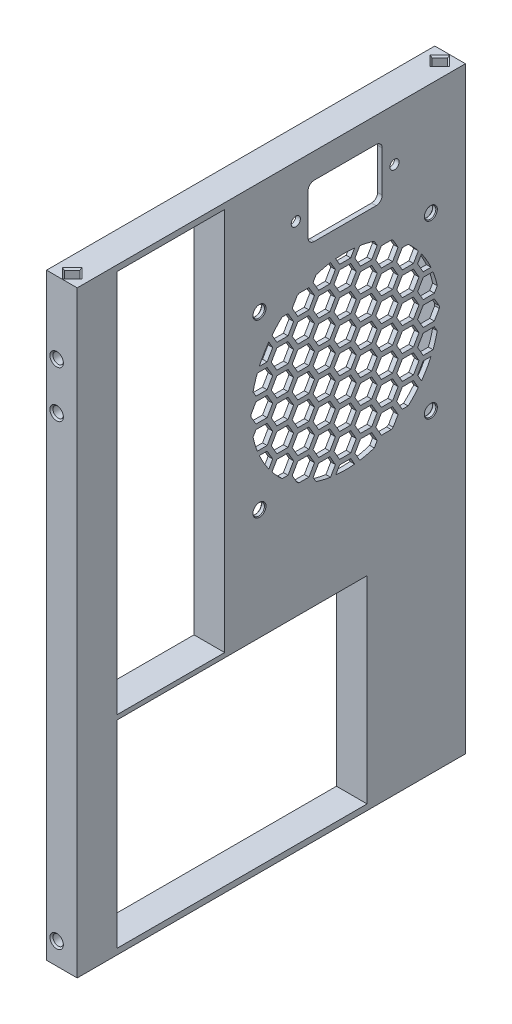
from build123d import *

# Parameters (mm, degrees)
SKETCH47_W                             = 160.866666667
SKETCH47_H                             = 247.65
SKETCH47_W_2                           = 44.704
SKETCH47_H_2                           = 159.004
SKETCH47_W_3                           = 103.7209
SKETCH47_H_3                           = 81.915
BOSS_EXTRUDE1_DEPTH                    = 12.7
BOSS_EXTRUDE6_DEPTH                    = 1.905
CUT_EXTRUDE4_REACH                     = 159.117
POWER_CABLE_ADAPTER_SCREWHOLES_D       = 3.7973
GPU_MOUNTING_SCREWHOLES_D              = 4.3053
GPU_MOUNTING_SCREWHOLES_DEPTH          = 4.572
GPU_MOUNTING_SCREWHOLES_CSINK_D        = 5.5753
GPU_MOUNTING_SCREWHOLES_CSINK_ANGLE    = 90
GPU_MOUNTING_SCREWHOLES_TIP            = 1.293442612
GPU_SCREW_ACCESS_HOLES_REACH           = 207.287
CUT_EXTRUDE1_REACH                     = 159.117
FILL_START                             = 10.795
FILL_PATTERN1_DEPTH                    = 1.905
SKETCH64_W                             = 82.922533333
SKETCH64_H                             = 128.9685
SKETCH64_R                             = 39
BOSS_EXTRUDE7_DEPTH                    = 1.905
F_3_16_0_1875_DIAMETER_HOLE1_D         = 4.7625
F_3_16_0_1875_DIAMETER_HOLE1_DEPTH     = 5.588
F_3_16_0_1875_DIAMETER_HOLE1_TIP       = 1.430799349
CHAMFER2_SIZE                          = 0.3175
BOTTOM_PINS_DEPTH                      = 6.35
FRONT_PINS_DEPTH                       = 6.35
CUT_EXTRUDE3_DEPTH                     = 6.35
PIN_CHAMFER_SIZE                       = 0.635
SKETCH69_W                             = 13.216466667
SKETCH69_H                             = 81.915
CUT_EXTRUDE2_DEPTH                     = 1.27
F_18_0_1695_DIAMETER_HOLE3_D           = 4.3053
F_18_0_1695_DIAMETER_HOLE3_DEPTH       = 8.382
F_18_0_1695_DIAMETER_HOLE3_CSINK_D     = 5.5753
F_18_0_1695_DIAMETER_HOLE3_CSINK_ANGLE = 90
F_18_0_1695_DIAMETER_HOLE3_TIP         = 1.293442612
SKETCH74_W                             = 5.08
SKETCH74_H                             = 83.82
CUT_EXTRUDE5_DEPTH                     = 1.27
CHAMFER3_SIZE                          = 1.27


# Read off the part's stored shape, not the designer's step: Fill Pattern1, #18 (0.1695) Diameter Hole2
with BuildPart() as part:
    # Sketch47 → Boss-Extrude1 (new body)
    with BuildSketch(Plane(origin=(0, 0, 0), x_dir=(0, 0, -1), z_dir=(1, 0, 0))):
        with Locations((11.578166667, 3.0734)):
            Rectangle(SKETCH47_W, SKETCH47_H)
        with Locations((-30.1117, 44.9834)):
            Rectangle(SKETCH47_W_2, SKETCH47_H_2, mode=Mode.SUBTRACT)
        Polygon((83.6295, 124.4854), (83.6295, -105.70845), (70.99935, -118.3386), (58.3692, -118.3386), (58.3692, -34.5186), (0.706966667, -34.5186), (0.706966667, 124.4854), align=None, mode=Mode.SUBTRACT)
        with Locations((-0.60325, -77.3811)):
            Rectangle(SKETCH47_W_3, SKETCH47_H_3, mode=Mode.SUBTRACT)
    extrude(amount=BOSS_EXTRUDE1_DEPTH)

    # Sketch50 → Boss-Extrude6 (add)
    with BuildSketch(Plane.ZY.offset(-12.7)):
        Polygon((-58.3692, -34.5186), (-58.3692, -118.3386), (-83.6295, -118.3386), (-83.6295, 124.4854), (-0.706966667, 124.4854), (-0.706966667, -34.5186), align=None)
    extrude(amount=BOSS_EXTRUDE6_DEPTH)

    # Sketch73 → Cut-Extrude4 (cut, up to next)
    with BuildSketch(Plane.ZY.offset(-10.795), mode=Mode.PRIVATE) as cut_extrude4_sk1:
        with BuildLine():
            Line((-26.801233333, 96.9899), (-26.801233333, 113.8809))
            ThreePointArc((-26.801233333, 113.8809), (-27.545182109, 115.676951224), (-29.341233333, 116.4209))
            Line((-29.341233333, 116.4209), (-54.995233333, 116.4209))
            ThreePointArc((-54.995233333, 116.4209), (-56.791284558, 115.676951224), (-57.535233333, 113.8809))
            Line((-57.535233333, 113.8809), (-57.535233333, 96.9899))
            ThreePointArc((-57.535233333, 96.9899), (-56.791284558, 95.193848776), (-54.995233333, 94.4499))
            Line((-54.995233333, 94.4499), (-29.341233333, 94.4499))
            ThreePointArc((-29.341233333, 94.4499), (-27.545182109, 95.193848776), (-26.801233333, 96.9899))
        make_face()
    cut_extrude4_tool1 = extrude(cut_extrude4_sk1.sketch, amount=-CUT_EXTRUDE4_REACH, mode=Mode.PRIVATE) & part.part
    add(cut_extrude4_tool1.solids().sort_by_distance((10.795, 105.4354, -42.168233))[0], mode=Mode.SUBTRACT)

    # power cable adapter screwholes (through all)
    with Locations(Plane.ZY.offset(-10.795)):
        with Locations((-62.615233333, 105.4354), (-21.721233333, 105.4354)):
            Hole(POWER_CABLE_ADAPTER_SCREWHOLES_D / 2)

    # GPU mounting screwholes
    with Locations(Plane(origin=(0, 0, -58.3692), x_dir=(-1, 0, 0), z_dir=(0, 0, -1))):
        with Locations((-5.08, -58.800000002), (-5.08, -79.120000002), (-5.08, -99.440000002), (-5.08, -38.354)):
            CounterSinkHole(GPU_MOUNTING_SCREWHOLES_D / 2, GPU_MOUNTING_SCREWHOLES_CSINK_D / 2, depth=GPU_MOUNTING_SCREWHOLES_DEPTH, counter_sink_angle=GPU_MOUNTING_SCREWHOLES_CSINK_ANGLE)
            with Locations((0, 0, -(GPU_MOUNTING_SCREWHOLES_DEPTH + GPU_MOUNTING_SCREWHOLES_TIP / 2))):  # 118° drill point
                Cone(0, GPU_MOUNTING_SCREWHOLES_D / 2, GPU_MOUNTING_SCREWHOLES_TIP, mode=Mode.SUBTRACT)

    # Sketch55 → GPU screw access holes (cut, up to next)
    with BuildSketch(Plane(origin=(0, 0, -92.0115), x_dir=(-1, 0, 0), z_dir=(0, 0, -1)), mode=Mode.PRIVATE) as gpu_screw_access_holes_sk1:
        Polygon((-0.680590949, -38.354), (-2.880295474, -34.544), (-7.279704526, -34.544), (-9.479409051, -38.354), (-7.279704526, -42.164), (-2.880295474, -42.164), align=None)
    gpu_screw_access_holes_tool1 = extrude(gpu_screw_access_holes_sk1.sketch, amount=-GPU_SCREW_ACCESS_HOLES_REACH, mode=Mode.PRIVATE) & part.part
    # Sketch55 → GPU screw access holes (cut, up to next)
    with BuildSketch(Plane(origin=(0, 0, -92.0115), x_dir=(-1, 0, 0), z_dir=(0, 0, -1)), mode=Mode.PRIVATE) as gpu_screw_access_holes_sk2:
        Polygon((-0.680590949, -58.800000002), (-2.880295474, -54.990000002), (-7.279704526, -54.990000002), (-9.479409051, -58.800000002), (-7.279704526, -62.610000002), (-2.880295474, -62.610000002), align=None)
    gpu_screw_access_holes_tool2 = extrude(gpu_screw_access_holes_sk2.sketch, amount=-GPU_SCREW_ACCESS_HOLES_REACH, mode=Mode.PRIVATE) & part.part
    # Sketch55 → GPU screw access holes (cut, up to next)
    with BuildSketch(Plane(origin=(0, 0, -92.0115), x_dir=(-1, 0, 0), z_dir=(0, 0, -1)), mode=Mode.PRIVATE) as gpu_screw_access_holes_sk3:
        Polygon((-0.680590949, -79.120000002), (-2.880295474, -75.310000002), (-7.279704526, -75.310000002), (-9.479409051, -79.120000002), (-7.279704526, -82.930000002), (-2.880295474, -82.930000002), align=None)
    gpu_screw_access_holes_tool3 = extrude(gpu_screw_access_holes_sk3.sketch, amount=-GPU_SCREW_ACCESS_HOLES_REACH, mode=Mode.PRIVATE) & part.part
    # Sketch55 → GPU screw access holes (cut, up to next)
    with BuildSketch(Plane(origin=(0, 0, -92.0115), x_dir=(-1, 0, 0), z_dir=(0, 0, -1)), mode=Mode.PRIVATE) as gpu_screw_access_holes_sk4:
        Polygon((-0.680590949, -99.440000002), (-2.880295474, -95.630000002), (-7.279704526, -95.630000002), (-9.479409051, -99.440000002), (-7.279704526, -103.250000002), (-2.880295474, -103.250000002), align=None)
    gpu_screw_access_holes_tool4 = extrude(gpu_screw_access_holes_sk4.sketch, amount=-GPU_SCREW_ACCESS_HOLES_REACH, mode=Mode.PRIVATE) & part.part
    add(gpu_screw_access_holes_tool1.solids().sort_by_distance((5.08, -38.354, -92.0115))[0], mode=Mode.SUBTRACT)
    add(gpu_screw_access_holes_tool2.solids().sort_by_distance((5.08, -58.8, -92.0115))[0], mode=Mode.SUBTRACT)
    add(gpu_screw_access_holes_tool3.solids().sort_by_distance((5.08, -79.12, -92.0115))[0], mode=Mode.SUBTRACT)
    add(gpu_screw_access_holes_tool4.solids().sort_by_distance((5.08, -99.44, -92.0115))[0], mode=Mode.SUBTRACT)

    # Sketch63 → Cut-Extrude1 (cut, up to next)
    with BuildSketch(Plane.ZY.offset(-10.795), mode=Mode.PRIVATE) as cut_extrude1_sk1:
        Polygon((-37.54943118, 44.9834), (-39.858832257, 48.9834), (-44.47763441, 48.9834), (-46.787035487, 44.9834), (-44.47763441, 40.9834), (-39.858832257, 40.9834), align=None)
    cut_extrude1_tool1 = extrude(cut_extrude1_sk1.sketch, amount=-CUT_EXTRUDE1_REACH, mode=Mode.PRIVATE) & part.part
    add(cut_extrude1_tool1.solids().sort_by_distance((10.795, 44.9834, -42.168233))[0], mode=Mode.SUBTRACT)

    # Fill Pattern1 outline → Fill Pattern1 (cut)
    with BuildSketch(Plane.YZ.offset(FILL_START)):
        Polygon((18.9834, -57.179340332), (14.9834, -54.869939256), (10.9834, -57.179340332), (10.9834, -61.798142486), (14.9834, -64.107543563), (18.9834, -61.798142486), align=None)
        Polygon((33.9834, -48.519086294), (29.9834, -46.209685218), (25.9834, -48.519086294), (25.9834, -53.137888448), (29.9834, -55.447289525), (33.9834, -53.137888448), align=None)
        Polygon((78.9834, -22.538324181), (74.9834, -20.228923104), (70.9834, -22.538324181), (70.9834, -27.157126334), (74.9834, -29.466527411), (78.9834, -27.157126334), align=None)
        Polygon((63.9834, -31.198578219), (59.9834, -28.889177142), (55.9834, -31.198578219), (55.9834, -35.817380372), (59.9834, -38.126781449), (63.9834, -35.817380372), align=None)
        Polygon((44.9834, -54.869939256), (40.9834, -57.179340332), (40.9834, -61.798142486), (44.9834, -64.107543563), (48.9834, -61.798142486), (48.9834, -57.179340332), align=None)
        Polygon((44.9834, -72.190447331), (40.9834, -74.499848408), (40.9834, -79.118650561), (44.9834, -81.428051638), (48.9834, -79.118650561), (48.9834, -74.499848408), align=None)
        Polygon((44.9834, -20.228923104), (40.9834, -22.538324181), (40.9834, -27.157126334), (44.9834, -29.466527411), (48.9834, -27.157126334), (48.9834, -22.538324181), align=None)
        Polygon((44.9834, -2.908415028), (40.9834, -5.217816105), (40.9834, -9.836618259), (44.9834, -12.146019335), (48.9834, -9.836618259), (48.9834, -5.217816105), align=None)
        Polygon((70.9834, -57.179340332), (70.9834, -61.798142486), (74.9834, -64.107543563), (78.9834, -61.798142486), (78.9834, -57.179340332), (74.9834, -54.869939256), align=None)
        Polygon((55.9834, -48.519086294), (55.9834, -53.137888448), (59.9834, -55.447289525), (63.9834, -53.137888448), (63.9834, -48.519086294), (59.9834, -46.209685218), align=None)
        Polygon((10.9834, -22.538324181), (10.9834, -27.157126334), (14.9834, -29.466527411), (18.9834, -27.157126334), (18.9834, -22.538324181), (14.9834, -20.228923104), align=None)
        Polygon((25.9834, -31.198578219), (25.9834, -35.817380372), (29.9834, -38.126781449), (33.9834, -35.817380372), (33.9834, -31.198578219), (29.9834, -28.889177142), align=None)
        Polygon((28.9834, -5.217816105), (24.9834, -2.908415028), (20.9834, -5.217816105), (20.9834, -9.836618259), (24.9834, -12.146019335), (28.9834, -9.836618259), align=None)
        Polygon((24.9834, -54.869939256), (20.9834, -57.179340332), (20.9834, -61.798142486), (24.9834, -64.107543563), (28.9834, -61.798142486), (28.9834, -57.179340332), align=None)
        Polygon((24.9834, -72.190447331), (20.9834, -74.499848408), (20.9834, -79.118650561), (24.9834, -81.428051638), (28.9834, -79.118650561), (28.9834, -74.499848408), align=None)
        Polygon((24.9834, -20.228923104), (20.9834, -22.538324181), (20.9834, -27.157126334), (24.9834, -29.466527411), (28.9834, -27.157126334), (28.9834, -22.538324181), align=None)
        Polygon((24.9834, -37.54943118), (20.9834, -39.858832257), (20.9834, -44.47763441), (24.9834, -46.787035487), (28.9834, -44.47763441), (28.9834, -39.858832257), align=None)
        Polygon((80.9834, -39.858832257), (80.9834, -44.47763441), (84.9834, -46.787035487), (88.9834, -44.47763441), (88.9834, -39.858832257), (84.9834, -37.54943118), align=None)
        Polygon((50.9834, -22.538324181), (50.9834, -27.157126334), (54.9834, -29.466527411), (58.9834, -27.157126334), (58.9834, -22.538324181), (54.9834, -20.228923104), align=None)
        Polygon((35.9834, -13.878070143), (35.9834, -18.496872297), (39.9834, -20.806273373), (43.9834, -18.496872297), (43.9834, -13.878070143), (39.9834, -11.568669066), align=None)
        Polygon((65.9834, -31.198578219), (65.9834, -35.817380372), (69.9834, -38.126781449), (73.9834, -35.817380372), (73.9834, -31.198578219), (69.9834, -28.889177142), align=None)
        Polygon((38.9834, -57.179340332), (34.9834, -54.869939256), (30.9834, -57.179340332), (30.9834, -61.798142486), (34.9834, -64.107543563), (38.9834, -61.798142486), align=None)
        Polygon((53.9834, -48.519086294), (49.9834, -46.209685218), (45.9834, -48.519086294), (45.9834, -53.137888448), (49.9834, -55.447289525), (53.9834, -53.137888448), align=None)
        Polygon((23.9834, -65.83959437), (19.9834, -63.530193293), (15.9834, -65.83959437), (15.9834, -70.458396524), (19.9834, -72.7677976), (23.9834, -70.458396524), align=None)
        Polygon((83.9834, -31.198578219), (79.9834, -28.889177142), (75.9834, -31.198578219), (75.9834, -35.817380372), (79.9834, -38.126781449), (83.9834, -35.817380372), align=None)
        Polygon((68.9834, -39.858832257), (64.9834, -37.54943118), (60.9834, -39.858832257), (60.9834, -44.47763441), (64.9834, -46.787035487), (68.9834, -44.47763441), align=None)
        Polygon((34.9834, -72.190447331), (30.9834, -74.499848408), (30.9834, -79.118650561), (34.9834, -81.428051638), (38.9834, -79.118650561), (38.9834, -74.499848408), align=None)
        Polygon((34.9834, -20.228923104), (30.9834, -22.538324181), (30.9834, -27.157126334), (34.9834, -29.466527411), (38.9834, -27.157126334), (38.9834, -22.538324181), align=None)
        Polygon((34.9834, -2.908415028), (30.9834, -5.217816105), (30.9834, -9.836618259), (34.9834, -12.146019335), (38.9834, -9.836618259), (38.9834, -5.217816105), align=None)
        Polygon((34.9834, -37.54943118), (30.9834, -39.858832257), (30.9834, -44.47763441), (34.9834, -46.787035487), (38.9834, -44.47763441), (38.9834, -39.858832257), align=None)
        Polygon((15.9834, -48.519086294), (15.9834, -53.137888448), (19.9834, -55.447289525), (23.9834, -53.137888448), (23.9834, -48.519086294), (19.9834, -46.209685218), align=None)
        Polygon((60.9834, -74.499848408), (60.9834, -79.118650561), (64.9834, -81.428051638), (68.9834, -79.118650561), (68.9834, -74.499848408), (64.9834, -72.190447331), align=None)
        Polygon((45.9834, -65.83959437), (45.9834, -70.458396524), (49.9834, -72.7677976), (53.9834, -70.458396524), (53.9834, -65.83959437), (49.9834, -63.530193293), align=None)
        Polygon((0.9834, -39.858832257), (0.9834, -44.47763441), (4.9834, -46.787035487), (8.9834, -44.47763441), (8.9834, -39.858832257), (4.9834, -37.54943118), align=None)
        Polygon((43.9834, -48.519086294), (39.9834, -46.209685218), (35.9834, -48.519086294), (35.9834, -53.137888448), (39.9834, -55.447289525), (43.9834, -53.137888448), align=None)
        Polygon((58.9834, -39.858832257), (54.9834, -37.54943118), (50.9834, -39.858832257), (50.9834, -44.47763441), (54.9834, -46.787035487), (58.9834, -44.47763441), align=None)
        Polygon((5.9834, -48.519086294), (5.9834, -53.137888448), (9.9834, -55.447289525), (13.9834, -53.137888448), (13.9834, -48.519086294), (9.9834, -46.209685218), align=None)
        Polygon((50.9834, -74.499848408), (50.9834, -79.118650561), (54.9834, -81.428051638), (58.9834, -79.118650561), (58.9834, -74.499848408), (54.9834, -72.190447331), align=None)
        Polygon((35.9834, -65.83959437), (35.9834, -70.458396524), (39.9834, -72.7677976), (43.9834, -70.458396524), (43.9834, -65.83959437), (39.9834, -63.530193293), align=None)
        Polygon((14.9834, -37.54943118), (10.9834, -39.858832257), (10.9834, -44.47763441), (14.9834, -46.787035487), (18.9834, -44.47763441), (18.9834, -39.858832257), align=None)
        Polygon((25.9834, -65.83959437), (25.9834, -70.458396524), (29.9834, -72.7677976), (33.9834, -70.458396524), (33.9834, -65.83959437), (29.9834, -63.530193293), align=None)
        Polygon((83.9834, -48.519086294), (79.9834, -46.209685218), (75.9834, -48.519086294), (75.9834, -53.137888448), (79.9834, -55.447289525), (83.9834, -53.137888448), align=None)
        Polygon((68.9834, -57.179340332), (64.9834, -54.869939256), (60.9834, -57.179340332), (60.9834, -61.798142486), (64.9834, -64.107543563), (68.9834, -61.798142486), align=None)
        Polygon((15.9834, -13.878070143), (15.9834, -18.496872297), (19.9834, -20.806273373), (23.9834, -18.496872297), (23.9834, -13.878070143), (19.9834, -11.568669066), align=None)
        Polygon((45.9834, -31.198578219), (45.9834, -35.817380372), (49.9834, -38.126781449), (53.9834, -35.817380372), (53.9834, -31.198578219), (49.9834, -28.889177142), align=None)
        Polygon((78.9834, -39.858832257), (74.9834, -37.54943118), (70.9834, -39.858832257), (70.9834, -44.47763441), (74.9834, -46.787035487), (78.9834, -44.47763441), align=None)
        Polygon((55.9834, -65.83959437), (55.9834, -70.458396524), (59.9834, -72.7677976), (63.9834, -70.458396524), (63.9834, -65.83959437), (59.9834, -63.530193293), align=None)
        Polygon((58.9834, -57.179340332), (54.9834, -54.869939256), (50.9834, -57.179340332), (50.9834, -61.798142486), (54.9834, -64.107543563), (58.9834, -61.798142486), align=None)
        Polygon((73.9834, -48.519086294), (69.9834, -46.209685218), (65.9834, -48.519086294), (65.9834, -53.137888448), (69.9834, -55.447289525), (73.9834, -53.137888448), align=None)
        Polygon((54.9834, -2.908415028), (50.9834, -5.217816105), (50.9834, -9.836618259), (54.9834, -12.146019335), (58.9834, -9.836618259), (58.9834, -5.217816105), align=None)
        Polygon((65.9834, -65.83959437), (65.9834, -70.458396524), (69.9834, -72.7677976), (73.9834, -70.458396524), (73.9834, -65.83959437), (69.9834, -63.530193293), align=None)
        Polygon((5.9834, -31.198578219), (5.9834, -35.817380372), (9.9834, -38.126781449), (13.9834, -35.817380372), (13.9834, -31.198578219), (9.9834, -28.889177142), align=None)
        Polygon((64.9834, -20.228923104), (60.9834, -22.538324181), (60.9834, -27.157126334), (64.9834, -29.466527411), (68.9834, -27.157126334), (68.9834, -22.538324181), align=None)
        Polygon((64.9834, -2.908415028), (60.9834, -5.217816105), (60.9834, -9.836618259), (64.9834, -12.146019335), (68.9834, -9.836618259), (68.9834, -5.217816105), align=None)
        Polygon((15.9834, -31.198578219), (15.9834, -35.817380372), (19.9834, -38.126781449), (23.9834, -35.817380372), (23.9834, -31.198578219), (19.9834, -28.889177142), align=None)
        Polygon((29.9834, -11.568669066), (25.9834, -13.878070143), (25.9834, -18.496872297), (29.9834, -20.806273373), (33.9834, -18.496872297), (33.9834, -13.878070143), align=None)
        Polygon((73.9834, -13.878070143), (69.9834, -11.568669066), (65.9834, -13.878070143), (65.9834, -18.496872297), (69.9834, -20.806273373), (73.9834, -18.496872297), align=None)
        Polygon((43.9834, -31.198578219), (39.9834, -28.889177142), (35.9834, -31.198578219), (35.9834, -35.817380372), (39.9834, -38.126781449), (43.9834, -35.817380372), align=None)
        Polygon((49.9834, -11.568669066), (45.9834, -13.878070143), (45.9834, -18.496872297), (49.9834, -20.806273373), (53.9834, -18.496872297), (53.9834, -13.878070143), align=None)
        Polygon((59.9834, -11.568669066), (55.9834, -13.878070143), (55.9834, -18.496872297), (59.9834, -20.806273373), (63.9834, -18.496872297), (63.9834, -13.878070143), align=None)
    extrude(amount=FILL_PATTERN1_DEPTH, mode=Mode.SUBTRACT)

    # Sketch64 → Boss-Extrude7 (add)
    with BuildSketch(Plane.ZY.offset(-10.795)):
        with Locations((-42.168233334, 29.96565)):
            Rectangle(SKETCH64_W, SKETCH64_H)
        with Locations((-42.168233333, 44.9834)):
            Circle(SKETCH64_R, mode=Mode.SUBTRACT)
    extrude(amount=-BOSS_EXTRUDE7_DEPTH)

    # 3/16 (0.1875) Diameter Hole1
    with Locations(Plane.ZY.offset(-10.795)):
        with Locations((-77.668233333, 80.4834), (-6.668233333, 80.4834), (-6.668233333, 9.4834), (-77.668233333, 9.4834)):
            Hole(F_3_16_0_1875_DIAMETER_HOLE1_D / 2, depth=F_3_16_0_1875_DIAMETER_HOLE1_DEPTH)
            with Locations((0, 0, -(F_3_16_0_1875_DIAMETER_HOLE1_DEPTH + F_3_16_0_1875_DIAMETER_HOLE1_TIP / 2))):  # 118° drill point
                Cone(0, F_3_16_0_1875_DIAMETER_HOLE1_D / 2, F_3_16_0_1875_DIAMETER_HOLE1_TIP, mode=Mode.SUBTRACT)

    # Chamfer2
    chamfer2_edges = [part.edges().sort_by_distance(p)[0] for p in [
        (12.7, 9.4834, -75.286983333),
        (10.795, 9.4834, -75.286983333),
        (12.7, 9.4834, -4.286983333),
        (10.795, 9.4834, -4.286983333),
        (12.7, 80.4834, -4.286983333),
        (10.795, 80.4834, -4.286983333),
        (12.7, 80.4834, -75.286983333),
        (10.795, 80.4834, -75.286983333),
    ]]
    chamfer(chamfer2_edges, length=CHAMFER2_SIZE)

    # Sketch60 → bottom pins (cut)
    with BuildSketch(Plane.XZ.offset(120.7516)):
        Polygon((9.525, 64.621833333), (6.35, 61.446833333), (3.175, 64.621833333), (6.35, 67.796833333), align=None)
        Polygon((3.175, -87.778166667), (6.35, -84.603166667), (9.525, -87.778166667), (6.35, -90.953166667), align=None)
    extrude(amount=-BOTTOM_PINS_DEPTH, mode=Mode.SUBTRACT)

    # Sketch61 → front pins (cut)
    with BuildSketch(Plane(origin=(0, 0, 0), x_dir=(0, 0, -1), z_dir=(1, 0, 0))):
        Polygon((84.603166667, 115.57), (87.778166667, 118.745), (90.953166667, 115.57), (87.778166667, 112.395), align=None)
        Polygon((-64.621833333, 118.745), (-61.446833333, 115.57), (-64.621833333, 112.395), (-67.796833333, 115.57), align=None)
        Polygon((84.603166667, 88.7984), (87.778166667, 91.9734), (90.953166667, 88.7984), (87.778166667, 85.6234), align=None)
    extrude(amount=FRONT_PINS_DEPTH, mode=Mode.SUBTRACT)

    # Sketch72 → Cut-Extrude3 (cut)
    with BuildSketch(Plane(origin=(0, 126.8984, 0), x_dir=(1, 0, 0), z_dir=(0, 1, 0))):
        Polygon((9.525, 87.778166667), (6.35, 84.603166667), (3.175, 87.778166667), (6.35, 90.953166667), align=None)
        Polygon((9.525, -64.621833333), (6.35, -67.796833333), (3.175, -64.621833333), (6.35, -61.446833333), align=None)
    extrude(amount=-CUT_EXTRUDE3_DEPTH, mode=Mode.SUBTRACT)

    # pin chamfer
    pin_chamfer_edges = [part.edges().sort_by_distance(p)[0] for p in [
        (7.9375, -114.4016, 66.209333333),
        (7.9375, -114.4016, 63.034333333),
        (4.7625, -114.4016, 63.034333333),
        (4.7625, -114.4016, 66.209333333),
        (7.9375, -120.7516, 66.209333333),
        (4.7625, -120.7516, 66.209333333),
        (4.7625, -120.7516, 63.034333333),
        (7.9375, -120.7516, 63.034333333),
        (4.7625, -114.4016, -89.365666667),
        (4.7625, -114.4016, -86.190666667),
        (7.9375, -114.4016, -86.190666667),
        (7.9375, -114.4016, -89.365666667),
        (4.7625, -120.7516, -89.365666667),
        (7.9375, -120.7516, -89.365666667),
        (7.9375, -120.7516, -86.190666667),
        (4.7625, -120.7516, -86.190666667),
        (0, 87.2109, -86.190666667),
        (0, 87.2109, -89.365666667),
        (0, 90.3859, -89.365666667),
        (0, 90.3859, -86.190666667),
        (6.35, 87.2109, -86.190666667),
        (6.35, 87.2109, -89.365666667),
        (6.35, 90.3859, -89.365666667),
        (6.35, 90.3859, -86.190666667),
        (0, 117.1575, 66.209333333),
        (0, 113.9825, 66.209333333),
        (0, 113.9825, 63.034333333),
        (0, 117.1575, 63.034333333),
        (6.35, 117.1575, 66.209333333),
        (6.35, 113.9825, 66.209333333),
        (6.35, 113.9825, 63.034333333),
        (6.35, 117.1575, 63.034333333),
        (0, 113.9825, -86.190666667),
        (0, 113.9825, -89.365666667),
        (0, 117.1575, -89.365666667),
        (0, 117.1575, -86.190666667),
        (6.35, 113.9825, -86.190666667),
        (6.35, 113.9825, -89.365666667),
        (6.35, 117.1575, -89.365666667),
        (6.35, 117.1575, -86.190666667),
        (7.9375, 120.5484, -89.365666667),
        (7.9375, 120.5484, -86.190666667),
        (4.7625, 120.5484, -86.190666667),
        (4.7625, 120.5484, -89.365666667),
        (7.9375, 126.8984, -89.365666667),
        (4.7625, 126.8984, -89.365666667),
        (4.7625, 126.8984, -86.190666667),
        (7.9375, 126.8984, -86.190666667),
        (7.9375, 120.5484, 63.034333333),
        (7.9375, 120.5484, 66.209333333),
        (4.7625, 120.5484, 66.209333333),
        (4.7625, 120.5484, 63.034333333),
        (7.9375, 126.8984, 63.034333333),
        (4.7625, 126.8984, 63.034333333),
        (4.7625, 126.8984, 66.209333333),
        (7.9375, 126.8984, 66.209333333),
    ]]
    chamfer(pin_chamfer_edges, length=PIN_CHAMFER_SIZE)

    # Sketch69 → Cut-Extrude2 (cut)
    with BuildSketch(Plane.ZY):
        with Locations((59.071933334, -77.3811)):
            Rectangle(SKETCH69_W, SKETCH69_H)
    extrude(amount=-CUT_EXTRUDE2_DEPTH, mode=Mode.SUBTRACT)

    # #18 (0.1695) Diameter Hole3
    with Locations(Plane.XY.offset(68.855166667)):
        with Locations((4.183016872, 77.703402), (4.183016872, -111.726599), (4.183016872, 97.0534)):
            CounterSinkHole(F_18_0_1695_DIAMETER_HOLE3_D / 2, F_18_0_1695_DIAMETER_HOLE3_CSINK_D / 2, depth=F_18_0_1695_DIAMETER_HOLE3_DEPTH, counter_sink_angle=F_18_0_1695_DIAMETER_HOLE3_CSINK_ANGLE)
            with Locations((0, 0, -(F_18_0_1695_DIAMETER_HOLE3_DEPTH + F_18_0_1695_DIAMETER_HOLE3_TIP / 2))):  # 118° drill point
                Cone(0, F_18_0_1695_DIAMETER_HOLE3_D / 2, F_18_0_1695_DIAMETER_HOLE3_TIP, mode=Mode.SUBTRACT)

    # #18 (0.1695) Diameter Hole2 outline → #18 (0.1695) Diameter Hole2 (revolve, cut)
    with BuildSketch(Plane(origin=(4.183016872, 97.0534, 0), x_dir=(1, 0, 0), z_dir=(0, -1, 0))):
        Polygon((2.15265, -91.3765), (2.15265, -83.6295), (0, -83.6295), (0, -92.0115), (2.78765, -92.0115), align=None)
    revolve(axis=Axis((4.183016872, 97.0534, 0), (0, 0, 1)), mode=Mode.SUBTRACT)

    # 18 _0.1695_ Diameter Hole2 2 outline → 18 _0.1695_ Diameter Hole2 2 (revolve, cut)
    with BuildSketch(Plane(origin=(4.175, -111.726599, 0), x_dir=(1, 0, 0), z_dir=(0, -1, 0))):
        Polygon((2.15265, -83.6295), (0, -82.336057388), (0, -92.0115), (2.78765, -92.0115), (2.15265, -91.3765), align=None)
    revolve(axis=Axis((4.175, -111.726599, 0), (0, 0, 1)), mode=Mode.SUBTRACT)

    # 18 _0.1695_ Diameter Hole2 3 outline → 18 _0.1695_ Diameter Hole2 3 (revolve, cut)
    with BuildSketch(Plane(origin=(4.375001, 77.703402, 0), x_dir=(1, 0, 0), z_dir=(0, -1, 0))):
        Polygon((2.15265, -91.3765), (2.15265, -83.6295), (0, -83.6295), (0, -92.0115), (2.78765, -92.0115), align=None)
    revolve(axis=Axis((4.375001, 77.703402, 0), (0, 0, 1)), mode=Mode.SUBTRACT)

    # Sketch74 → Cut-Extrude5 (cut)
    with BuildSketch(Plane.ZY.offset(-10.795)):
        with Locations((-60.9092, -76.4286)):
            Rectangle(SKETCH74_W, SKETCH74_H)
    extrude(amount=-CUT_EXTRUDE5_DEPTH, mode=Mode.SUBTRACT)

    # Chamfer3
    chamfer3_edges = [part.edges().sort_by_distance(p)[0] for p in [
        (10.795, -76.4286, -63.4492),
    ]]
    chamfer(chamfer3_edges, length=CHAMFER3_SIZE - 0.0001)  # a hair under: the kernel refuses the full size


solid = part.part
